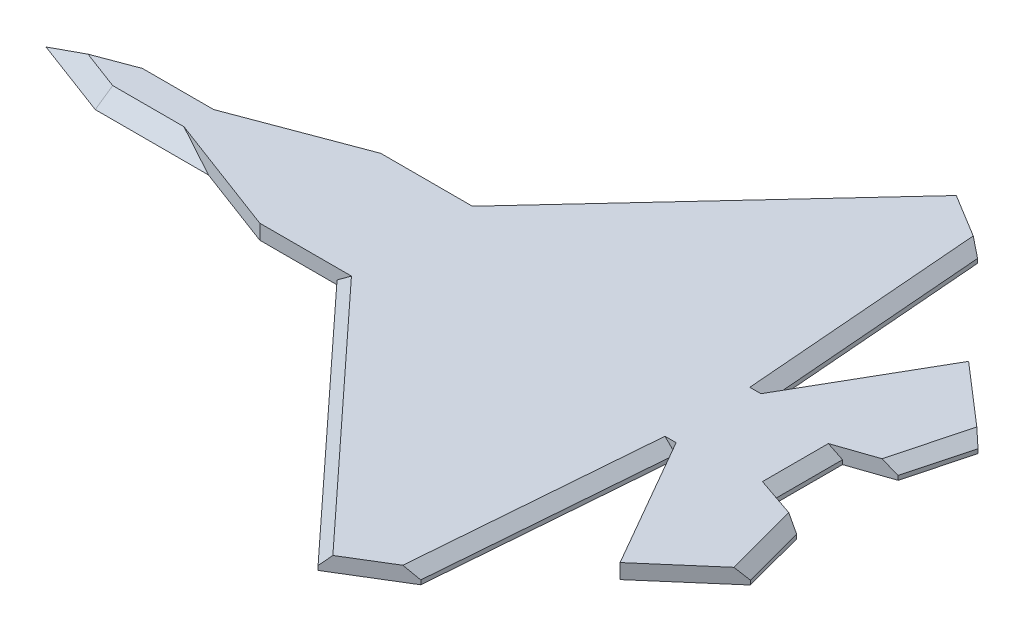
from build123d import *

# Parameters (mm, degrees)
BOSS_EXTRUDE1_DEPTH = 0.7
CHAMFER1_SIZE       = 1
CHAMFER2_SIZE       = 0.5


with BuildPart() as part:
    # Sketch1 → Boss-Extrude1 (new body)
    with BuildSketch(Plane(origin=(0, 0, 0), x_dir=(1, 0, 0), z_dir=(0, 1, 0))):
        Polygon((0.284238857, 0.048748246), (4.822239021, 1.752850979), (11.041039678, 1.752850979), (14.137088798, 2.915474508), (17.798659013, 2.915474508), (29.070766186, 15.087446012), (32.094208001, 13.244081421), (32.986673125, 2.05865414), (33.011493829, 2.05865414), (36.605140674, 8.306952125), (39.91645027, 5.441925055), (39.11764025, 2.453830764), (37.15585938, 1.781640495), (37.15585938, -1.684144002), (39.11764025, -2.356334271), (39.91645027, -5.344428562), (36.605140674, -8.209455633), (33.011493829, -1.961157647), (32.986673125, -1.961157647), (32.094208001, -13.146584929), (29.070766186, -14.98994952), (17.798659013, -2.817978016), (14.137088798, -2.817978016), (11.041039678, -1.655354487), (4.822239021, -1.655354487), align=None)
    extrude(amount=BOSS_EXTRUDE1_DEPTH)

    # Chamfer1
    # the kernel refuses this chamfer: 1 mm, written as the material it takes off along each edge
    with BuildSketch(Plane(origin=(2.250556033, 0.7, -1.752850979), x_dir=(0, -0.9996219169112968, -0.02749587661058627), z_dir=(1, 0, 0))) as chamfer1_piece_1_section:
        Polygon((CHAMFER1_SIZE * 0.999621916911, -CHAMFER1_SIZE * 0.0274958766106), (-CHAMFER1_SIZE * 0.0274958766106, -CHAMFER1_SIZE * 0.999621916911), (0, 0), align=None)
    chamfer1_piece_1 = extrude(amount=11.362166633, mode=Mode.PRIVATE)
    chamfer1_piece_1 = split(chamfer1_piece_1, bisect_by=Plane(origin=(6.727578787, 0.358780421, -0.133066883), z_dir=(-0.3515489139570331, 0, -0.9361695151497034)), keep=Keep.TOP, mode=Mode.PRIVATE)
    add(chamfer1_piece_1, mode=Mode.SUBTRACT)
    with BuildSketch(Plane(origin=(-2.123292359, 0.7, 0.855324115), x_dir=(-0.00966614556074823, -0.9996219169112968, -0.025740801475148727), z_dir=(0.9361695151497034, 0, -0.351548913957033)), Plane(origin=(7.229770237, 0.7, 2.559426848), x_dir=(-0.00966614556074825, -0.9996219169112968, 0.025740801475148775), z_dir=(-0.9361695151497034, 0, -0.351548913957033))) as chamfer1_piece_2:
        Polygon((CHAMFER1_SIZE * 0.999621916911, -CHAMFER1_SIZE * 0.0274958766106), (-CHAMFER1_SIZE * 0.0274958766106, -CHAMFER1_SIZE * 0.999621916911), (0, 0), align=None)
    extrude(amount=9.990778854, mode=Mode.SUBTRACT)
    with BuildSketch(Plane(origin=(13.612722666, 0.7, 1.655354487), x_dir=(0, -0.9996219169112968, 0.02749587661058627), z_dir=(-1, 0, 0))) as chamfer1_piece_3_section:
        Polygon((CHAMFER1_SIZE * 0.999621916911, -CHAMFER1_SIZE * 0.0274958766106), (-CHAMFER1_SIZE * 0.0274958766106, -CHAMFER1_SIZE * 0.999621916911), (0, 0), align=None)
    chamfer1_piece_3 = extrude(amount=11.362166633, mode=Mode.PRIVATE)
    chamfer1_piece_3 = split(chamfer1_piece_3, bisect_by=Plane(origin=(6.727578787, 0.358780421, 0.035570391), z_dir=(-0.3515489139570331, 0, 0.9361695151497034)), keep=Keep.TOP, mode=Mode.PRIVATE)
    add(chamfer1_piece_3, mode=Mode.SUBTRACT)

    # Chamfer2
    chamfer2_edges = [part.edges().sort_by_distance(p)[0] for p in [
        (23.4347126, 0.7, 8.903963768),
        (32.540440563, 0.7, 7.553871288),
        (39.51704526, 0.7, 3.850381417),
        (37.15585938, 0.7, -0.048748246),
        (39.51704526, 0.7, -3.947877909),
        (32.540440563, 0.7, -7.65136778),
        (23.4347126, 0.7, -9.00146026),
    ]]
    chamfer(chamfer2_edges, length=CHAMFER2_SIZE)


solid = part.part
